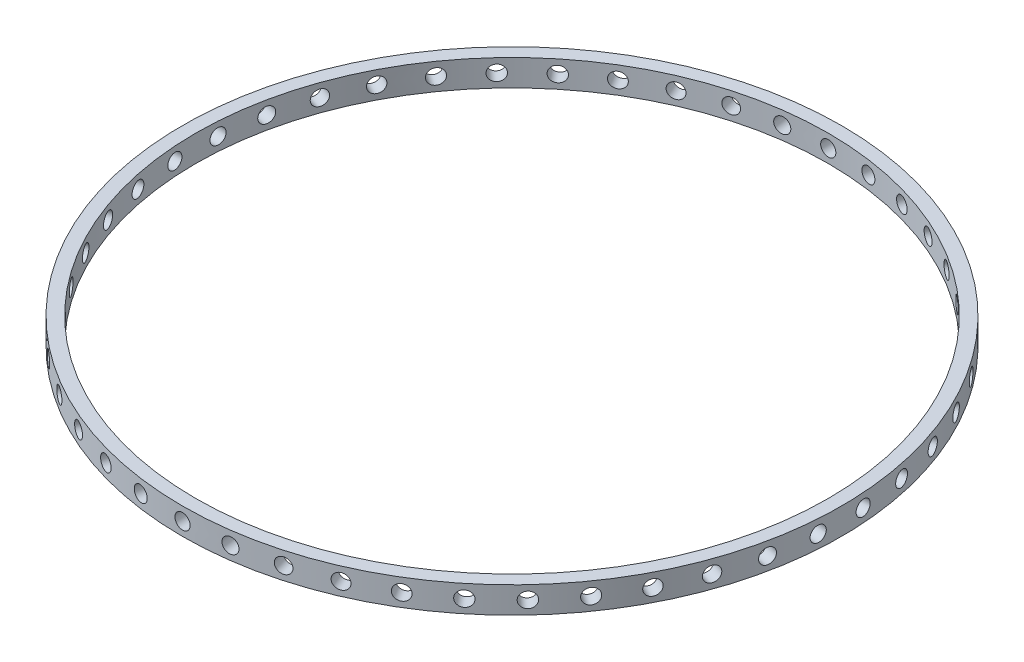
from build123d import *

# Parameters (mm, degrees)
SKETCH1_R           = 79.375
SKETCH1_R_2         = 76.2
BOSS_EXTRUDE1_DEPTH = 6.35
CIRPATTERN1_COUNT   = 46


with BuildPart() as part:
    # Sketch1 → Boss-Extrude1 (new body)
    with BuildSketch(Plane(origin=(0, 0, 0), x_dir=(1, 0, 0), z_dir=(0, 1, 0))):
        Circle(SKETCH1_R)
        Circle(SKETCH1_R_2, mode=Mode.SUBTRACT)
    extrude(amount=BOSS_EXTRUDE1_DEPTH)

    # Sketch4 → #6 Clearance Hole2 (revolve, cut)
    with BuildSketch(Plane(origin=(0, 3.175, 79.375), x_dir=(0, -1, 0), z_dir=(1, 0, 0))):
        Polygon((0, 0), (0, 13.7988539), (1.8288, 12.7), (1.8288, 0), align=None)
    f_6_clearance_hole2 = revolve(axis=Axis((0, 3.175, 85.725), (0, 0, -1)), mode=Mode.SUBTRACT)

    # CirPattern1: #6 Clearance Hole2 ×46 about axis
    cirpattern1_axis = Axis((0, 6.35, 0), (0, -1, 0))
    for i in range(1, CIRPATTERN1_COUNT):
        add(f_6_clearance_hole2.rotate(cirpattern1_axis, i * 360 / CIRPATTERN1_COUNT), mode=Mode.SUBTRACT)


solid = part.part
